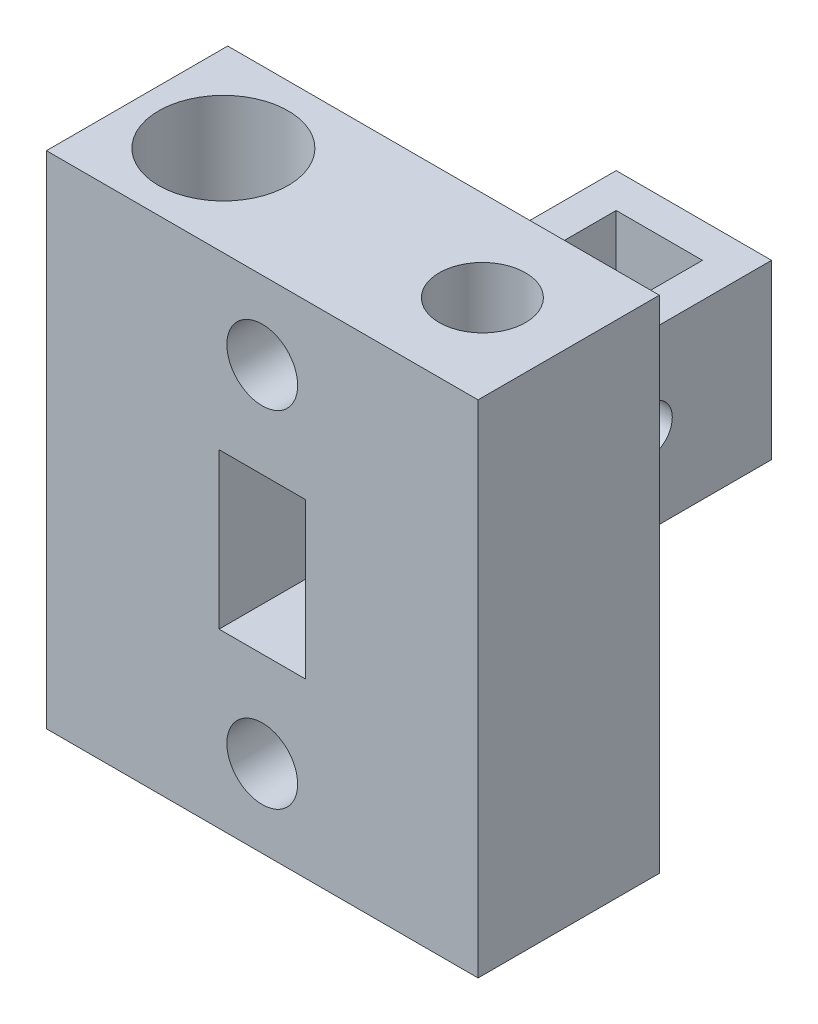
from build123d import *

# Parameters (mm, degrees)
SKETCH1_W           = 50
SKETCH1_H           = 21
BOSS_EXTRUDE1_DEPTH = 58
SKETCH3_R           = 7.5
CUT_EXTRUDE1_DEPTH  = 24
CUT_EXTRUDE2_REACH  = 66.025
SKETCH4_R           = 5
CUT_EXTRUDE3_START  = -24
SKETCH5_R           = 7.5
CUT_EXTRUDE3_DEPTH  = 24
CUT_EXTRUDE4_REACH  = 66.025
SKETCH6_R           = 4.5
CUT_EXTRUDE5_REACH  = 68.558
SKETCH8_W           = 10
SKETCH8_H           = 18
SKETCH7_R           = 4.1
CUT_EXTRUDE6_DEPTH  = 15
SKETCH11_W          = 4
SKETCH11_H          = 20
BOSS_EXTRUDE2_DEPTH = 25
SKETCH12_W          = 18
SKETCH12_H          = 20
BOSS_EXTRUDE3_DEPTH = 4
CUT_EXTRUDE7_DEPTH  = 78.975957833


with BuildPart() as part:
    # Sketch1 → Boss-Extrude1 (new body)
    with BuildSketch(Plane(origin=(0, 0, 0), x_dir=(1, 0, 0), z_dir=(0, 1, 0))):
        Rectangle(SKETCH1_W, SKETCH1_H)
    extrude(amount=BOSS_EXTRUDE1_DEPTH)

    # Sketch3 → Cut-Extrude1 (cut)
    with BuildSketch(Plane(origin=(0, 58, 0), x_dir=(1, 0, 0), z_dir=(0, 1, 0))):
        with Locations((-15, 0)):
            Circle(SKETCH3_R)
    extrude(amount=-CUT_EXTRUDE1_DEPTH, mode=Mode.SUBTRACT)

    # Sketch4 → Cut-Extrude2 (cut, up to next)
    with BuildSketch(Plane(origin=(0, 58, 0), x_dir=(1, 0, 0), z_dir=(0, 1, 0)), mode=Mode.PRIVATE) as cut_extrude2_sk1:
        with Locations((15, 0)):
            Circle(SKETCH4_R)
    cut_extrude2_tool1 = extrude(cut_extrude2_sk1.sketch, amount=-CUT_EXTRUDE2_REACH, mode=Mode.PRIVATE) & part.part
    add(cut_extrude2_tool1.solids().sort_by_distance((15, 58, 0))[0], mode=Mode.SUBTRACT)

    # Sketch5 → Cut-Extrude3 (cut)
    with BuildSketch(Plane.XZ.offset(CUT_EXTRUDE3_START)):
        with Locations((-15, 0)):
            Circle(SKETCH5_R)
    extrude(amount=CUT_EXTRUDE3_DEPTH, mode=Mode.SUBTRACT)

    # Sketch6 → Cut-Extrude4 (cut, up to next)
    with BuildSketch(Plane.XZ, mode=Mode.PRIVATE) as cut_extrude4_sk1:
        with Locations((-15, 0)):
            Circle(SKETCH6_R)
    cut_extrude4_tool1 = extrude(cut_extrude4_sk1.sketch, amount=-CUT_EXTRUDE4_REACH, mode=Mode.PRIVATE) & part.part
    add(cut_extrude4_tool1.solids().sort_by_distance((-15, 0, 0))[0], mode=Mode.SUBTRACT)

    # Sketch8 → Cut-Extrude5 (cut, up to next)
    with BuildSketch(Plane.XY.offset(10.5), mode=Mode.PRIVATE) as cut_extrude5_sk1:
        with Locations((0, 29)):
            Rectangle(SKETCH8_W, SKETCH8_H)
    cut_extrude5_tool1 = extrude(cut_extrude5_sk1.sketch, amount=-CUT_EXTRUDE5_REACH, mode=Mode.PRIVATE) & part.part
    add(cut_extrude5_tool1.solids().sort_by_distance((0, 29, 10.5))[0], mode=Mode.SUBTRACT)

    # Sketch7 → Cut-Extrude6 (cut)
    with BuildSketch(Plane.XY.offset(10.5)):
        with Locations((0, 49)):
            Circle(SKETCH7_R)
        with Locations((0, 9)):
            Circle(SKETCH7_R)
    extrude(amount=-CUT_EXTRUDE6_DEPTH, mode=Mode.SUBTRACT)

    # Sketch11 → Boss-Extrude2 (add)
    with BuildSketch(Plane(origin=(0, 0, -10.5), x_dir=(-1, 0, 0), z_dir=(0, 0, -1))):
        with Locations((7, 29)):
            Rectangle(SKETCH11_W, SKETCH11_H)
        with Locations((-7, 29)):
            Rectangle(SKETCH11_W, SKETCH11_H)
    extrude(amount=BOSS_EXTRUDE2_DEPTH)

    # Sketch12 → Boss-Extrude3 (add)
    with BuildSketch(Plane(origin=(0, 0, -35.5), x_dir=(-1, 0, 0), z_dir=(0, 0, -1))):
        with Locations((0, 29)):
            Rectangle(SKETCH12_W, SKETCH12_H)
    extrude(amount=BOSS_EXTRUDE3_DEPTH)

    # Sketch13 → Cut-Extrude7 (cut, through all)
    with BuildSketch(Plane(origin=(9, 0, 0), x_dir=(0, 0, -1), z_dir=(1, 0, 0))):
        with BuildLine():
            Line((16.25, 31.75), (25.25, 31.75))
            ThreePointArc((25.25, 31.75), (28, 29), (25.25, 26.25))
            Line((25.25, 26.25), (16.25, 26.25))
            ThreePointArc((16.25, 26.25), (13.5, 29), (16.25, 31.75))
        make_face()
    extrude(amount=-CUT_EXTRUDE7_DEPTH, mode=Mode.SUBTRACT)


solid = part.part
